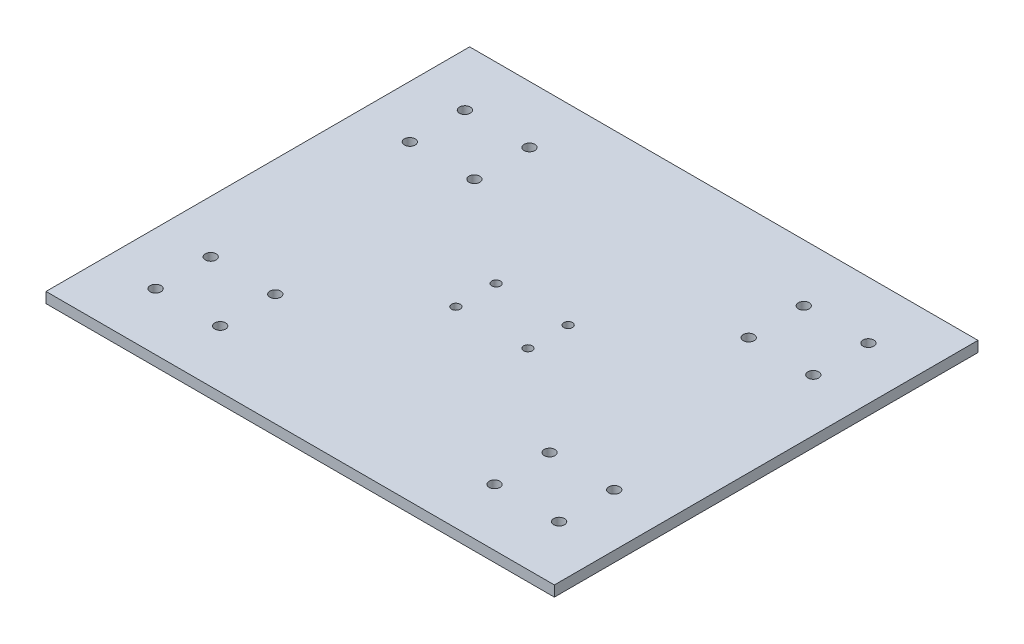
from build123d import *

# Parameters (mm, degrees)
SKETCH1_W           = 240
SKETCH1_H           = 200
BOSS_EXTRUDE1_DEPTH = 2.5
SKETCH2_R           = 2.55
CUT_EXTRUDE1_DEPTH  = 157.284996081
SKETCH3_R           = 2.05
CUT_EXTRUDE2_DEPTH  = 157.284996081


with BuildPart() as part:
    # Sketch1 → Boss-Extrude1 (new, symmetric)
    with BuildSketch(Plane(origin=(0, 0, 0), x_dir=(1, 0, 0), z_dir=(0, 1, 0))):
        Rectangle(SKETCH1_W, SKETCH1_H)
    extrude(amount=BOSS_EXTRUDE1_DEPTH, both=True)

    # Sketch2 → Cut-Extrude1 (cut, through all)
    with BuildSketch(Plane(origin=(0, 2.5, 0), x_dir=(1, 0, 0), z_dir=(0, 1, 0))):
        with Locations((-95.25, 73)):
            Circle(SKETCH2_R)
        with Locations((-95.25, 47)):
            Circle(SKETCH2_R)
        with Locations((-64.75, 73)):
            Circle(SKETCH2_R)
        with Locations((-64.75, 47)):
            Circle(SKETCH2_R)
        with Locations((-95.25, -47)):
            Circle(SKETCH2_R)
        with Locations((-95.25, -73)):
            Circle(SKETCH2_R)
        with Locations((-64.75, -73)):
            Circle(SKETCH2_R)
        with Locations((-64.75, -47)):
            Circle(SKETCH2_R)
        with Locations((95.25, -47)):
            Circle(SKETCH2_R)
        with Locations((64.75, -47)):
            Circle(SKETCH2_R)
        with Locations((64.75, -73)):
            Circle(SKETCH2_R)
        with Locations((95.25, -73)):
            Circle(SKETCH2_R)
        with Locations((64.75, 73)):
            Circle(SKETCH2_R)
        with Locations((64.75, 47)):
            Circle(SKETCH2_R)
        with Locations((95.25, 73)):
            Circle(SKETCH2_R)
        with Locations((95.25, 47)):
            Circle(SKETCH2_R)
    extrude(amount=-CUT_EXTRUDE1_DEPTH, mode=Mode.SUBTRACT)

    # Sketch3 → Cut-Extrude2 (cut, through all)
    with BuildSketch(Plane(origin=(0, 2.5, 0), x_dir=(1, 0, 0), z_dir=(0, 1, 0))):
        with Locations((-17, 9.5)):
            Circle(SKETCH3_R)
        with Locations((17, 9.5)):
            Circle(SKETCH3_R)
        with Locations((17, -9.5)):
            Circle(SKETCH3_R)
        with Locations((-17, -9.5)):
            Circle(SKETCH3_R)
    extrude(amount=-CUT_EXTRUDE2_DEPTH, mode=Mode.SUBTRACT)


solid = part.part
